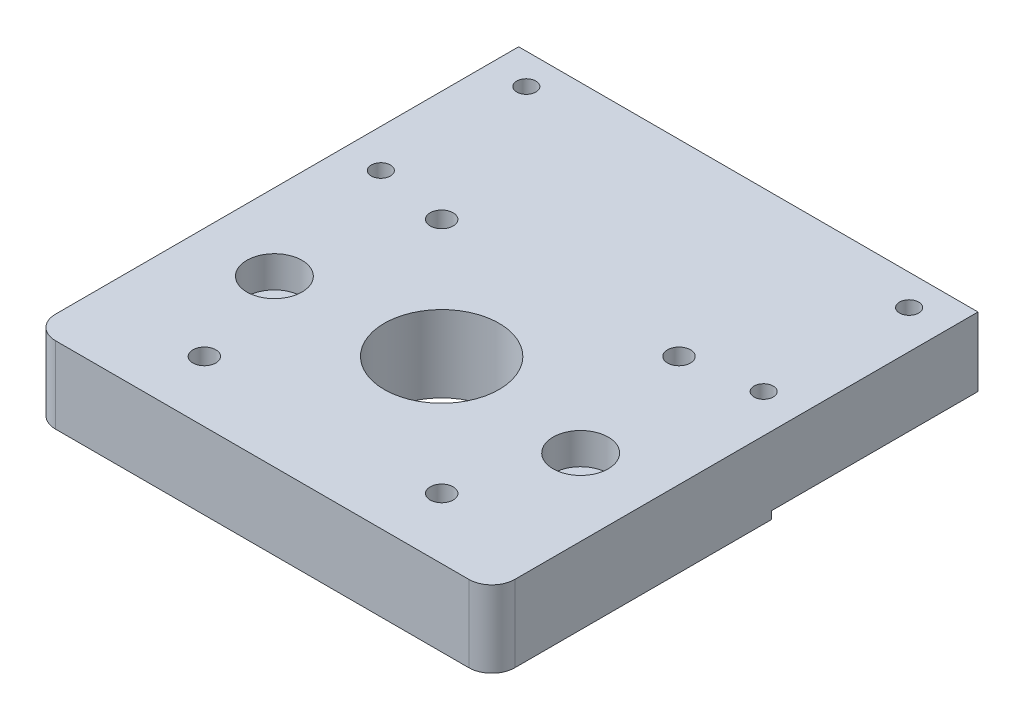
from build123d import *

# Parameters (mm, degrees)
SKETCH_1_W           = 60
SKETCH_1_H           = 63.5
EXTRUDE_1_DEPTH      = 10
FILLET_1_R           = 3
SKETCH_3_R           = 7.5
CUT_EXTRUDE_2_DEPTH  = 45.811410377
CUT_EXTRUDE_3_DEPTH  = 1
SKETCH_5_R           = 1.25
CUT_EXTRUDE_4_DEPTH  = 45.811410377
SKETCH_7_R           = 4
CUT_EXTRUDE_6_DEPTH  = 1
SKETCH_8_R           = 2
CUT_EXTRUDE_7_DEPTH  = 45.811410377
SKETCH_9_R           = 3.6
CUT_EXTRUDE_8_DEPTH  = 4.1
SKETCH_10_R          = 1.5
CUT_EXTRUDE_9_DEPTH  = 45.811410377
SKETCH_11_R          = 2.85
CUT_EXTRUDE_10_DEPTH = 2.9


with BuildPart() as part:
    # 草图1 → 凸台-拉伸1 (new body)
    with BuildSketch(Plane(origin=(0, 0, 0), x_dir=(1, 0, 0), z_dir=(0, 1, 0))):
        Rectangle(SKETCH_1_W, SKETCH_1_H)
    extrude(amount=EXTRUDE_1_DEPTH)

    # 圆角1
    fillet_1_edges = [part.edges().sort_by_distance(p)[0] for p in [
        (30, 5, 31.75),
        (-30, 5, 31.75),
    ]]
    fillet(fillet_1_edges, radius=FILLET_1_R)

    # 草图3 → 切除-拉伸2 (cut, through all)
    with BuildSketch(Plane(origin=(0, 10, 0), x_dir=(1, 0, 0), z_dir=(0, 1, 0))):
        with Locations((0, -8.302922201)):
            Circle(SKETCH_3_R)
    extrude(amount=-CUT_EXTRUDE_2_DEPTH, mode=Mode.SUBTRACT)

    # 草图4 → 切除-拉伸3 (cut)
    with BuildSketch(Plane.XZ):
        with BuildLine():
            Line((20, -4.75), (30, -4.75))
            Line((30, -4.75), (30, -31.75))
            Line((30, -31.75), (20, -31.75))
            Line((20, -31.75), (20, -7.25))
            ThreePointArc((20, -7.25), (18.75, -6), (20, -4.75))
        make_face()
        with BuildLine():
            Line((-20, -4.75), (-30, -4.75))
            Line((-30, -4.75), (-30, -31.75))
            Line((-30, -31.75), (-20, -31.75))
            Line((-20, -31.75), (-20, -7.25))
            ThreePointArc((-20, -7.25), (-18.75, -6), (-20, -4.75))
        make_face()
    extrude(amount=-CUT_EXTRUDE_3_DEPTH, mode=Mode.SUBTRACT)

    # 草图5 → 切除-拉伸4 (cut, through all)
    with BuildSketch(Plane(origin=(0, 10, 0), x_dir=(1, 0, 0), z_dir=(0, 1, 0))):
        with Locations((25, 27.75)):
            Circle(SKETCH_5_R)
        with Locations((25, 8.75)):
            Circle(SKETCH_5_R)
        with Locations((-25, 27.75)):
            Circle(SKETCH_5_R)
        with Locations((-25, 8.75)):
            Circle(SKETCH_5_R)
    extrude(amount=-CUT_EXTRUDE_4_DEPTH, mode=Mode.SUBTRACT)

    # 草图7 → 切除-拉伸6 (cut)
    with BuildSketch(Plane.XZ):
        with Locations((-20, 10.15)):
            Circle(SKETCH_7_R)
        with Locations((20, 10.15)):
            Circle(SKETCH_7_R)
    extrude(amount=-CUT_EXTRUDE_6_DEPTH, mode=Mode.SUBTRACT)

    # 草图8 → 切除-拉伸7 (cut, through all)
    with BuildSketch(Plane(origin=(0, 10, 0), x_dir=(1, 0, 0), z_dir=(0, 1, 0))):
        with Locations((-20, -10.15)):
            Circle(SKETCH_8_R)
        with Locations((20, -10.15)):
            Circle(SKETCH_8_R)
    extrude(amount=-CUT_EXTRUDE_7_DEPTH, mode=Mode.SUBTRACT)

    # 草图9 → 切除-拉伸8 (cut)
    with BuildSketch(Plane(origin=(0, 10, 0), x_dir=(1, 0, 0), z_dir=(0, 1, 0))):
        with Locations((-20, -10.15)):
            Circle(SKETCH_9_R)
        with Locations((20, -10.15)):
            Circle(SKETCH_9_R)
    extrude(amount=-CUT_EXTRUDE_8_DEPTH, mode=Mode.SUBTRACT)

    # 草图10 → 切除-拉伸9 (cut, through all)
    with BuildSketch(Plane(origin=(0, 10, 0), x_dir=(1, 0, 0), z_dir=(0, 1, 0))):
        with Locations((-15.5, 7.197077799)):
            Circle(SKETCH_10_R)
        with Locations((15.5, 7.197077799)):
            Circle(SKETCH_10_R)
        with Locations((-15.5, -23.802922201)):
            Circle(SKETCH_10_R)
        with Locations((15.5, -23.802922201)):
            Circle(SKETCH_10_R)
    extrude(amount=-CUT_EXTRUDE_9_DEPTH, mode=Mode.SUBTRACT)

    # 草图11 → 切除-拉伸10 (cut)
    with BuildSketch(Plane.XZ):
        with Locations((-15.5, 23.802922201)):
            Circle(SKETCH_11_R)
        with Locations((15.5, 23.802922201)):
            Circle(SKETCH_11_R)
        with Locations((-15.5, -7.197077799)):
            Circle(SKETCH_11_R)
        with Locations((15.5, -7.197077799)):
            Circle(SKETCH_11_R)
    extrude(amount=-CUT_EXTRUDE_10_DEPTH, mode=Mode.SUBTRACT)


solid = part.part
